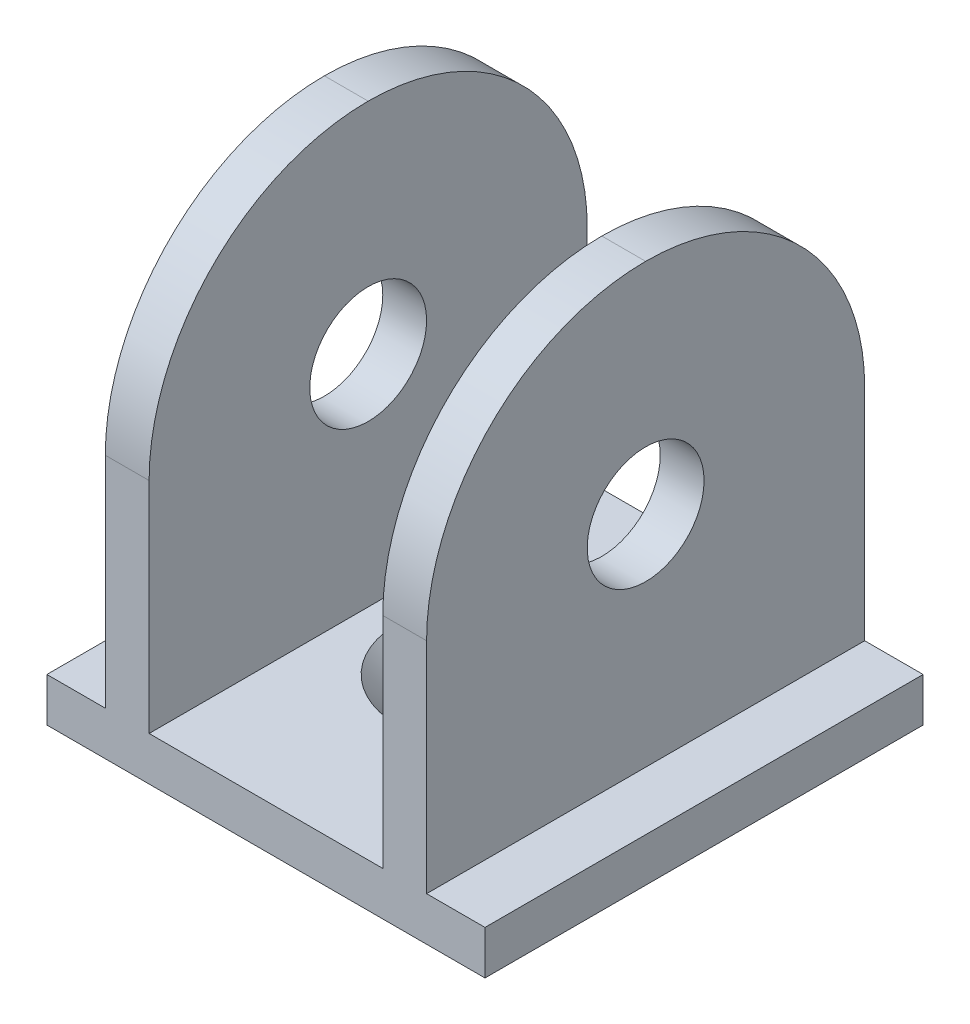
from build123d import *

# Parameters (mm, degrees)
CROQUIS1_W              = 30
CROQUIS1_H              = 30
SALIENTE_EXTRUIR1_DEPTH = 3
CROQUIS2_W              = 3
CROQUIS2_H              = 30
SALIENTE_EXTRUIR2_DEPTH = 30
REDONDEO1_R             = 15
CROQUIS3_R              = 4
CORTAR_EXTRUIR1_DEPTH   = 45.609416046
CROQUIS4_R              = 3
CORTAR_EXTRUIR2_DEPTH   = 37.742346142
CHAFL_N1_SIZE           = 3


with BuildPart() as part:
    # Croquis1 → Saliente-Extruir1 (new body)
    with BuildSketch(Plane(origin=(0, 0, 0), x_dir=(1, 0, 0), z_dir=(0, 1, 0))):
        Rectangle(CROQUIS1_W, CROQUIS1_H)
    extrude(amount=SALIENTE_EXTRUIR1_DEPTH)

    # Croquis2 → Saliente-Extruir2 (add)
    with BuildSketch(Plane(origin=(0, 3, 0), x_dir=(1, 0, 0), z_dir=(0, 1, 0))):
        with Locations((-9.5, 0)):
            Rectangle(CROQUIS2_W, CROQUIS2_H)
        with Locations((9.5, 0)):
            Rectangle(CROQUIS2_W, CROQUIS2_H)
    extrude(amount=SALIENTE_EXTRUIR2_DEPTH)

    # Redondeo1
    redondeo1_edges = [part.edges().sort_by_distance(p)[0] for p in [
        (-9.5, 33, -15),
        (9.5, 33, -15),
        (9.5, 33, 15),
        (-9.5, 33, 15),
    ]]
    fillet(redondeo1_edges, radius=REDONDEO1_R - 0.0001)  # a hair under: the kernel refuses the full size

    # Croquis3 → Cortar-Extruir1 (cut, through all)
    with BuildSketch(Plane(origin=(11, 0, 0), x_dir=(0, 0, -1), z_dir=(1, 0, 0))):
        with Locations((0, 18)):
            Circle(CROQUIS3_R)
    extrude(amount=-CORTAR_EXTRUIR1_DEPTH, mode=Mode.SUBTRACT)

    # Croquis4 → Cortar-Extruir2 (cut, through all)
    with BuildSketch(Plane(origin=(0, 3, 0), x_dir=(1, 0, 0), z_dir=(0, 1, 0))):
        with Locations(Location((0, 0, 0), (0, 0, 270))):
            Circle(CROQUIS4_R)
    extrude(amount=-CORTAR_EXTRUIR2_DEPTH, mode=Mode.SUBTRACT)

    # Chaflán1
    chafl_n1_edges = [part.edges().sort_by_distance(p)[0] for p in [
        (0, 3, -3),
    ]]
    chamfer(chafl_n1_edges, length=CHAFL_N1_SIZE - 0.0001)  # a hair under: the kernel refuses the full size


solid = part.part
